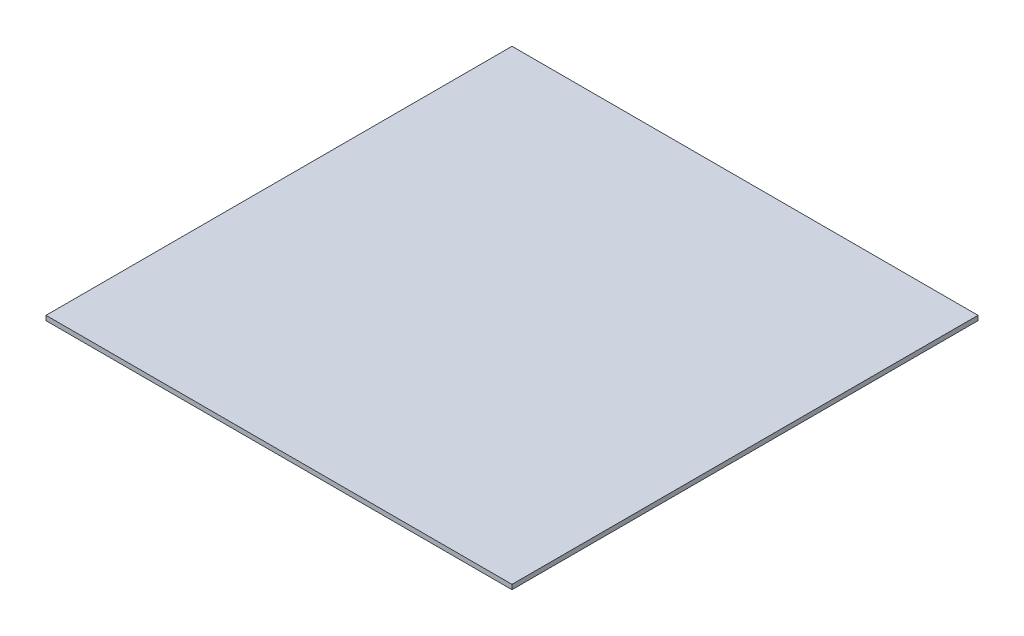
from build123d import *

# Parameters (mm, degrees)
ESQUISSE1_W        = 300
ESQUISSE1_H        = 300
BOSS_EXTRU_1_DEPTH = 3


with BuildPart() as part:
    # Esquisse1 → Boss.-Extru.1 (new body)
    with BuildSketch(Plane(origin=(0, 0, 0), x_dir=(1, 0, 0), z_dir=(0, 1, 0))):
        Rectangle(ESQUISSE1_W, ESQUISSE1_H)
    extrude(amount=BOSS_EXTRU_1_DEPTH)


solid = part.part
